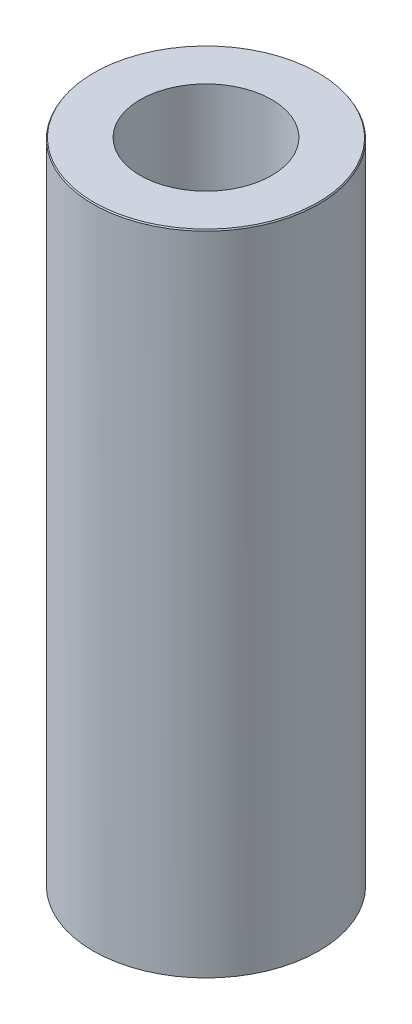
from build123d import *
from OCP.BRepFilletAPI import BRepFilletAPI_MakeChamfer

# Parameters (mm, degrees)
SKETCH1_R           = 42.5
BOSS_EXTRUDE1_DEPTH = 244.245501333
SKETCH2_R           = 24.752428584
CUT_EXTRUDE1_DEPTH  = 252.532035577
CHAMFER1_SIZE       = 0.489254407
CHAMFER1_SIZE2      = 0.282471164


with BuildPart() as part:
    # Sketch1 → Boss-Extrude1 (new body)
    with BuildSketch(Plane(origin=(0, 0, 0), x_dir=(1, 0, 0), z_dir=(0, 1, 0))):
        Circle(SKETCH1_R)
    extrude(amount=BOSS_EXTRUDE1_DEPTH)

    # Sketch2 → Cut-Extrude1 (cut, through all)
    with BuildSketch(Plane(origin=(0, 0, 0), x_dir=(1, 0, 0), z_dir=(0, 1, 0))):
        Circle(SKETCH2_R)
    extrude(amount=CUT_EXTRUDE1_DEPTH, mode=Mode.SUBTRACT)

    # Chamfer1: one chamfer whose edges measure the first distance from different faces: ONE call of the kernel's chamfer builder (chamfer() names one face for all edges)
    chamfer1_edges_1 = [part.edges().sort_by_distance(p)[0] for p in [
        (-42.5, 244.245501333, 0),
    ]]
    chamfer1_side_1 = [part.faces().sort_by_distance(p)[0] for p in [
        (-42.5, 122.122750667, 0),
    ]]
    chamfer1_edges_2 = [part.edges().sort_by_distance(p)[0] for p in [
        (-42.5, 0, 0),
    ]]
    chamfer1_side_2 = [part.faces().sort_by_distance(p)[0] for p in [
        (-41.297918472, 0, 0),
    ]]
    chamfer1 = BRepFilletAPI_MakeChamfer(part.part.solid().wrapped)
    for e in chamfer1_edges_1:
        chamfer1.Add(CHAMFER1_SIZE, CHAMFER1_SIZE2, e.wrapped, chamfer1_side_1[0].wrapped)  # the first distance lies on this face
    for e in chamfer1_edges_2:
        chamfer1.Add(CHAMFER1_SIZE, CHAMFER1_SIZE2, e.wrapped, chamfer1_side_2[0].wrapped)  # the first distance lies on this face
    add(Compound.cast(chamfer1.Shape()), mode=Mode.REPLACE)


solid = part.part
